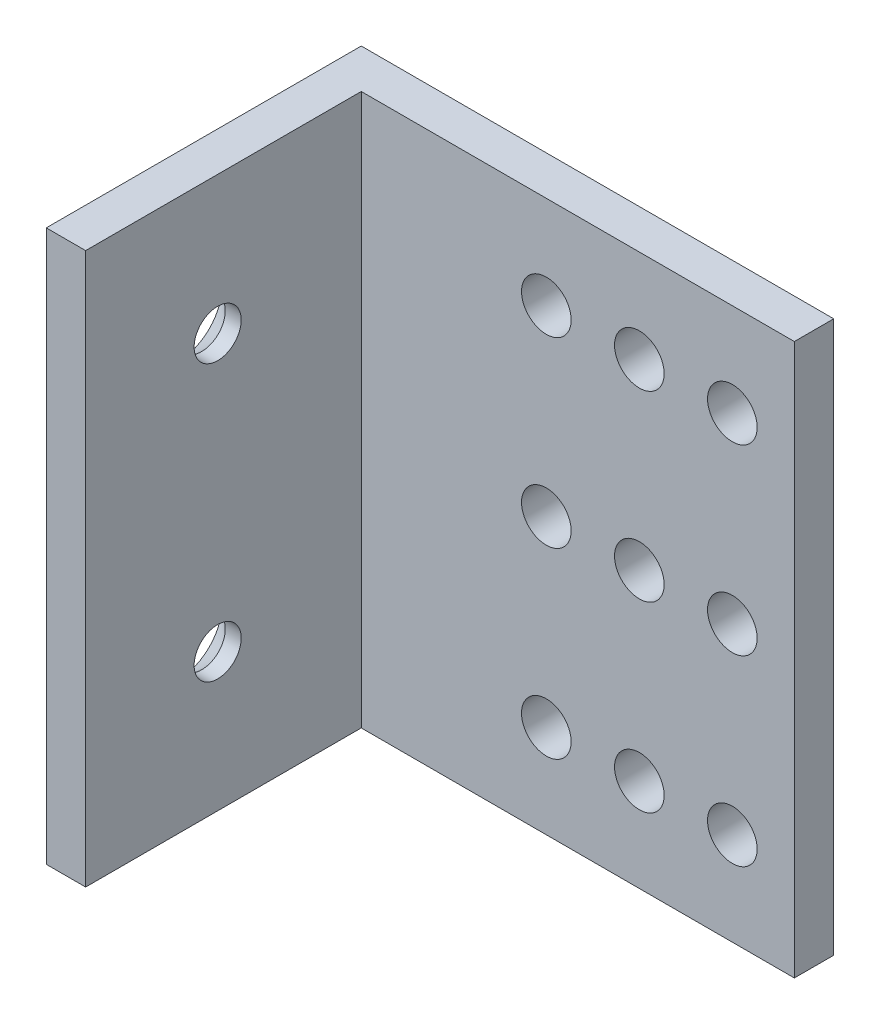
from build123d import *

# Parameters (mm, degrees)
BOSS_EXTRUDE1_DEPTH                            = 22.225
CSK_FOR_6_FLAT_HEAD_MACHINE_SCREW1_D           = 3.7973
CSK_FOR_6_FLAT_HEAD_MACHINE_SCREW1_CSINK_D     = 7.0866
CSK_FOR_6_FLAT_HEAD_MACHINE_SCREW1_CSINK_ANGLE = 82
SKETCH6_R                                      = 2
CUT_EXTRUDE2_DEPTH                             = 39.75581408


with BuildPart() as part:
    # Sketch1 → Boss-Extrude1 (new, symmetric)
    with BuildSketch(Plane(origin=(0, 0, 0), x_dir=(1, 0, 0), z_dir=(0, 1, 0))):
        Polygon((-19.05, -12.7), (-15.875, -12.7), (-15.875, 9.525), (19.05, 9.525), (19.05, 12.7), (-19.05, 12.7), align=None)
    extrude(amount=BOSS_EXTRUDE1_DEPTH, both=True)

    # CSK for #6 Flat Head Machine Screw1 (through all)
    with Locations(Plane.ZY.offset(19.05)):
        with Locations((2.055, 11.1125)):
            csk_for_6_flat_head_machine_screw1 = CounterSinkHole(CSK_FOR_6_FLAT_HEAD_MACHINE_SCREW1_D / 2, CSK_FOR_6_FLAT_HEAD_MACHINE_SCREW1_CSINK_D / 2, counter_sink_angle=CSK_FOR_6_FLAT_HEAD_MACHINE_SCREW1_CSINK_ANGLE)

    # Sketch6 → Cut-Extrude2 (cut, through all)
    with BuildSketch(Plane(origin=(0, 0, -12.7), x_dir=(-1, 0, 0), z_dir=(0, 0, -1))):
        with Locations((-14.05, -14.725)):
            Circle(SKETCH6_R)
        with Locations((-6.55, -14.725)):
            Circle(SKETCH6_R)
        with Locations((-6.55, 0)):
            Circle(SKETCH6_R)
        with Locations((-6.55, 14.725)):
            Circle(SKETCH6_R)
        with Locations((-14.05, 0)):
            Circle(SKETCH6_R)
        with Locations((-14.05, 14.725)):
            Circle(SKETCH6_R)
        with Locations((0.95, -14.725)):
            Circle(SKETCH6_R)
        with Locations((0.95, 0)):
            Circle(SKETCH6_R)
        with Locations((0.95, 14.725)):
            Circle(SKETCH6_R)
    extrude(amount=-CUT_EXTRUDE2_DEPTH, mode=Mode.SUBTRACT)

    # Mirror1: CSK for #6 Flat Head Machine Screw1 across plane
    add(csk_for_6_flat_head_machine_screw1.mirror(Plane.ZX), mode=Mode.SUBTRACT)


solid = part.part
